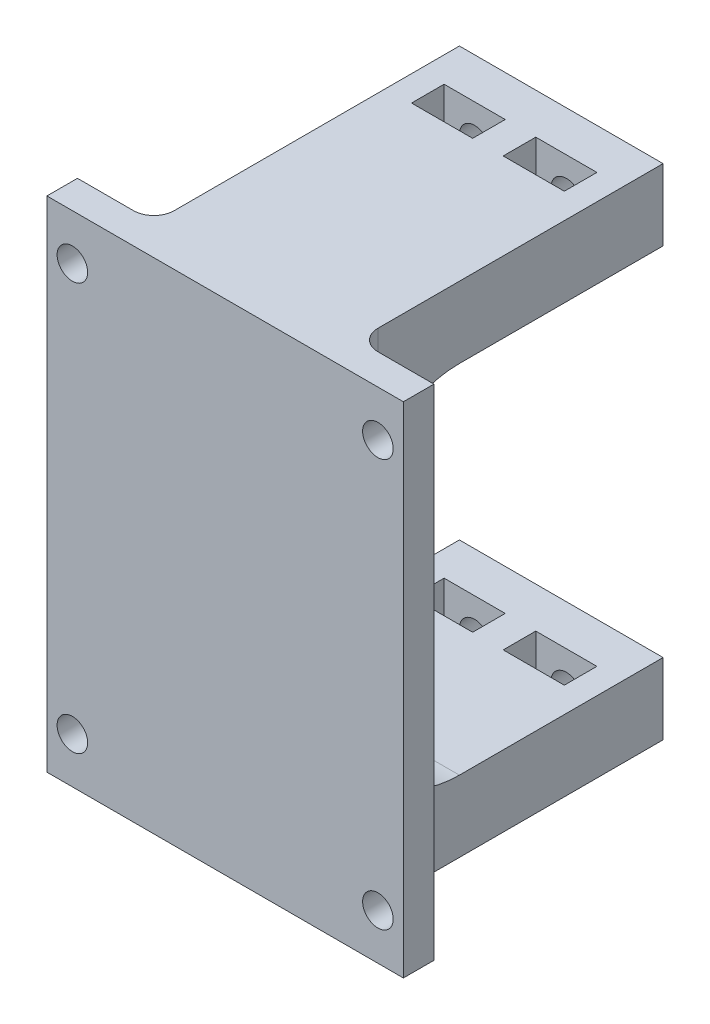
from build123d import *

# Parameters (mm, degrees)
BOSS_EXTRUDE1_DEPTH = 49
CUT_EXTRUDE1_REACH  = 60.562
SKETCH2_W           = 30
SKETCH2_H           = 35
CUT_EXTRUDE2_REACH  = 62.06
SKETCH3_R           = 1.5
FILLET1_R           = 10
FILLET2_R           = 2
SKETCH4_W           = 6
SKETCH4_H           = 3.2
CUT_EXTRUDE3_DEPTH  = 55.584796508
CUT_EXTRUDE4_START  = -15
SKETCH5_R           = 1.5
CUT_EXTRUDE4_DEPTH  = 74.07658745


with BuildPart() as part:
    # Sketch1 → Boss-Extrude1 (new body)
    with BuildSketch(Plane(origin=(0, 0, 0), x_dir=(1, 0, 0), z_dir=(0, 1, 0))):
        Polygon((10, 16.5), (-10, 16.5), (-10, -13.5), (-17.5, -13.5), (-17.5, -16.5), (17.5, -16.5), (17.5, -13.5), (10, -13.5), align=None)
    extrude(amount=BOSS_EXTRUDE1_DEPTH)

    # Sketch2 → Cut-Extrude1 (cut, up to next)
    with BuildSketch(Plane(origin=(10, 0, 0), x_dir=(0, 0, -1), z_dir=(1, 0, 0)), mode=Mode.PRIVATE) as cut_extrude1_sk1:
        with Locations((1.5, 24.5)):
            Rectangle(SKETCH2_W, SKETCH2_H)
    cut_extrude1_tool1 = extrude(cut_extrude1_sk1.sketch, amount=-CUT_EXTRUDE1_REACH, mode=Mode.PRIVATE) & part.part
    add(cut_extrude1_tool1.solids().sort_by_distance((10, 24.5, -1.5))[0], mode=Mode.SUBTRACT)

    # Sketch3 → Cut-Extrude2 (cut, up to next)
    with BuildSketch(Plane(origin=(0, 0, 13.5), x_dir=(-1, 0, 0), z_dir=(0, 0, -1)), mode=Mode.PRIVATE) as cut_extrude2_sk1:
        with Locations((-15, 44.5)):
            Circle(SKETCH3_R)
    cut_extrude2_tool1 = extrude(cut_extrude2_sk1.sketch, amount=-CUT_EXTRUDE2_REACH, mode=Mode.PRIVATE) & part.part
    # Sketch3 → Cut-Extrude2 (cut, up to next)
    with BuildSketch(Plane(origin=(0, 0, 13.5), x_dir=(-1, 0, 0), z_dir=(0, 0, -1)), mode=Mode.PRIVATE) as cut_extrude2_sk2:
        with Locations((15, 44.5)):
            Circle(SKETCH3_R)
    cut_extrude2_tool2 = extrude(cut_extrude2_sk2.sketch, amount=-CUT_EXTRUDE2_REACH, mode=Mode.PRIVATE) & part.part
    # Sketch3 → Cut-Extrude2 (cut, up to next)
    with BuildSketch(Plane(origin=(0, 0, 13.5), x_dir=(-1, 0, 0), z_dir=(0, 0, -1)), mode=Mode.PRIVATE) as cut_extrude2_sk3:
        with Locations((-15, 4.5)):
            Circle(SKETCH3_R)
    cut_extrude2_tool3 = extrude(cut_extrude2_sk3.sketch, amount=-CUT_EXTRUDE2_REACH, mode=Mode.PRIVATE) & part.part
    # Sketch3 → Cut-Extrude2 (cut, up to next)
    with BuildSketch(Plane(origin=(0, 0, 13.5), x_dir=(-1, 0, 0), z_dir=(0, 0, -1)), mode=Mode.PRIVATE) as cut_extrude2_sk4:
        with Locations((15, 4.5)):
            Circle(SKETCH3_R)
    cut_extrude2_tool4 = extrude(cut_extrude2_sk4.sketch, amount=-CUT_EXTRUDE2_REACH, mode=Mode.PRIVATE) & part.part
    add(cut_extrude2_tool1.solids().sort_by_distance((15, 44.5, 13.5))[0], mode=Mode.SUBTRACT)
    add(cut_extrude2_tool2.solids().sort_by_distance((-15, 44.5, 13.5))[0], mode=Mode.SUBTRACT)
    add(cut_extrude2_tool3.solids().sort_by_distance((15, 4.5, 13.5))[0], mode=Mode.SUBTRACT)
    add(cut_extrude2_tool4.solids().sort_by_distance((-15, 4.5, 13.5))[0], mode=Mode.SUBTRACT)

    # Fillet1
    fillet1_edges = [part.edges().sort_by_distance(p)[0] for p in [
        (0, 7, 13.5),
        (0, 42, 13.5),
    ]]
    fillet(fillet1_edges, radius=FILLET1_R)

    # Fillet2
    fillet2_edges = [part.edges().sort_by_distance(p)[0] for p in [
        (-10, 40.5, 13.5),
        (-10, 8.5, 13.5),
        (10, 40.5, 13.5),
        (10, 8.5, 13.5),
    ]]
    fillet(fillet2_edges, radius=FILLET2_R)

    # Sketch4 → Cut-Extrude3 (cut, through all)
    with BuildSketch(Plane(origin=(0, 49, 0), x_dir=(1, 0, 0), z_dir=(0, 1, 0))):
        with Locations((-4.5, 10.9)):
            Rectangle(SKETCH4_W, SKETCH4_H)
        with Locations((4.5, 10.9)):
            Rectangle(SKETCH4_W, SKETCH4_H)
    extrude(amount=-CUT_EXTRUDE3_DEPTH, mode=Mode.SUBTRACT)

    # Sketch5 → Cut-Extrude4 (cut)
    with BuildSketch(Plane(origin=(0, 0, -9.3), x_dir=(-1, 0, 0), z_dir=(0, 0, -1)).offset(CUT_EXTRUDE4_START)):
        with Locations((4.5, 45.5)):
            Circle(SKETCH5_R)
        with Locations((4.5, 3.5)):
            Circle(SKETCH5_R)
    cut_extrude4 = extrude(amount=CUT_EXTRUDE4_DEPTH, mode=Mode.SUBTRACT)

    # Mirror1: Cut-Extrude4 across plane
    add(cut_extrude4.mirror(Plane(origin=(0, 0, 0), x_dir=(0, 0, 1), z_dir=(1, 0, 0))), mode=Mode.SUBTRACT)


solid = part.part
